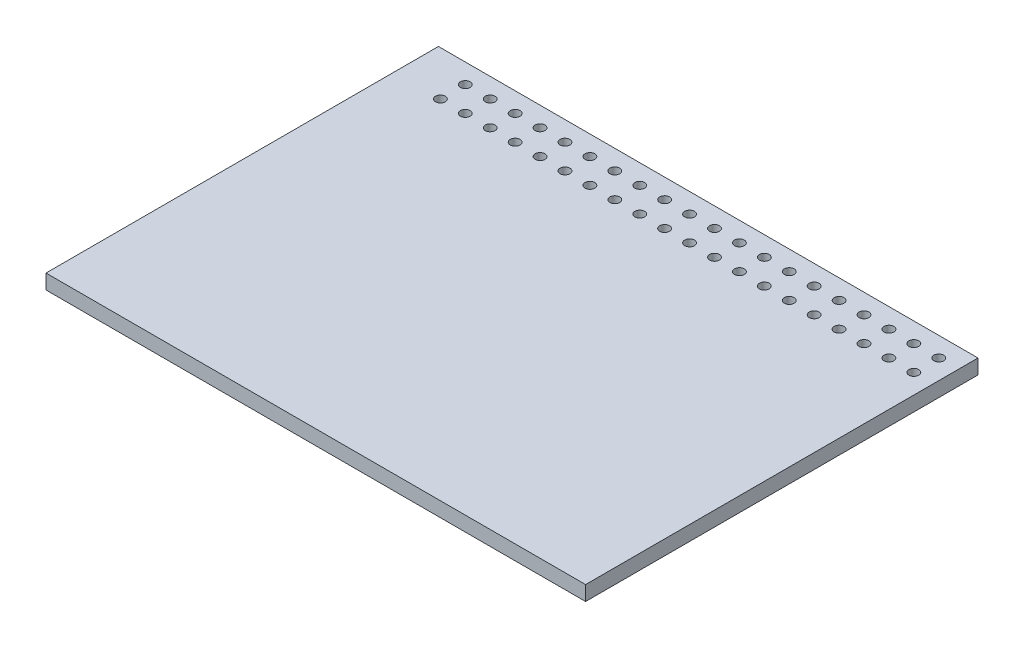
from build123d import *

# Parameters (mm, degrees)
SKETCH1_W           = 55
SKETCH1_H           = 40
SKETCH1_R           = 0.5
BOSS_EXTRUDE1_DEPTH = 1.5


with BuildPart() as part:
    # Sketch1 → Boss-Extrude1 (new body)
    with BuildSketch(Plane(origin=(0, 0, 0), x_dir=(1, 0, 0), z_dir=(0, 1, 0))):
        Rectangle(SKETCH1_W, SKETCH1_H)
        with Locations((25.5, 18)):
            Circle(SKETCH1_R, mode=Mode.SUBTRACT)
        with Locations((22.96, 18)):
            Circle(SKETCH1_R, mode=Mode.SUBTRACT)
        with Locations((20.42, 18)):
            Circle(SKETCH1_R, mode=Mode.SUBTRACT)
        with Locations((17.88, 18)):
            Circle(SKETCH1_R, mode=Mode.SUBTRACT)
        with Locations((15.34, 18)):
            Circle(SKETCH1_R, mode=Mode.SUBTRACT)
        with Locations((12.8, 18)):
            Circle(SKETCH1_R, mode=Mode.SUBTRACT)
        with Locations((10.26, 18)):
            Circle(SKETCH1_R, mode=Mode.SUBTRACT)
        with Locations((7.72, 18)):
            Circle(SKETCH1_R, mode=Mode.SUBTRACT)
        with Locations((5.18, 18)):
            Circle(SKETCH1_R, mode=Mode.SUBTRACT)
        with Locations((2.64, 18)):
            Circle(SKETCH1_R, mode=Mode.SUBTRACT)
        with Locations((0.1, 18)):
            Circle(SKETCH1_R, mode=Mode.SUBTRACT)
        with Locations((-2.44, 18)):
            Circle(SKETCH1_R, mode=Mode.SUBTRACT)
        with Locations((-4.98, 18)):
            Circle(SKETCH1_R, mode=Mode.SUBTRACT)
        with Locations((-7.52, 18)):
            Circle(SKETCH1_R, mode=Mode.SUBTRACT)
        with Locations((-10.06, 18)):
            Circle(SKETCH1_R, mode=Mode.SUBTRACT)
        with Locations((-12.6, 18)):
            Circle(SKETCH1_R, mode=Mode.SUBTRACT)
        with Locations((-15.14, 18)):
            Circle(SKETCH1_R, mode=Mode.SUBTRACT)
        with Locations((-17.68, 18)):
            Circle(SKETCH1_R, mode=Mode.SUBTRACT)
        with Locations((-20.22, 18)):
            Circle(SKETCH1_R, mode=Mode.SUBTRACT)
        with Locations((-22.76, 18)):
            Circle(SKETCH1_R, mode=Mode.SUBTRACT)
        with Locations((22.96, 15.46)):
            Circle(SKETCH1_R, mode=Mode.SUBTRACT)
        with Locations((20.42, 15.46)):
            Circle(SKETCH1_R, mode=Mode.SUBTRACT)
        with Locations((17.88, 15.46)):
            Circle(SKETCH1_R, mode=Mode.SUBTRACT)
        with Locations((15.34, 15.46)):
            Circle(SKETCH1_R, mode=Mode.SUBTRACT)
        with Locations((12.8, 15.46)):
            Circle(SKETCH1_R, mode=Mode.SUBTRACT)
        with Locations((10.26, 15.46)):
            Circle(SKETCH1_R, mode=Mode.SUBTRACT)
        with Locations((7.72, 15.46)):
            Circle(SKETCH1_R, mode=Mode.SUBTRACT)
        with Locations((5.18, 15.46)):
            Circle(SKETCH1_R, mode=Mode.SUBTRACT)
        with Locations((2.64, 15.46)):
            Circle(SKETCH1_R, mode=Mode.SUBTRACT)
        with Locations((0.1, 15.46)):
            Circle(SKETCH1_R, mode=Mode.SUBTRACT)
        with Locations((-2.44, 15.46)):
            Circle(SKETCH1_R, mode=Mode.SUBTRACT)
        with Locations((-4.98, 15.46)):
            Circle(SKETCH1_R, mode=Mode.SUBTRACT)
        with Locations((-7.52, 15.46)):
            Circle(SKETCH1_R, mode=Mode.SUBTRACT)
        with Locations((-10.06, 15.46)):
            Circle(SKETCH1_R, mode=Mode.SUBTRACT)
        with Locations((-12.6, 15.46)):
            Circle(SKETCH1_R, mode=Mode.SUBTRACT)
        with Locations((-15.14, 15.46)):
            Circle(SKETCH1_R, mode=Mode.SUBTRACT)
        with Locations((-17.68, 15.46)):
            Circle(SKETCH1_R, mode=Mode.SUBTRACT)
        with Locations((-20.22, 15.46)):
            Circle(SKETCH1_R, mode=Mode.SUBTRACT)
        with Locations((-22.76, 15.46)):
            Circle(SKETCH1_R, mode=Mode.SUBTRACT)
        with Locations((25.5, 15.46)):
            Circle(SKETCH1_R, mode=Mode.SUBTRACT)
    extrude(amount=BOSS_EXTRUDE1_DEPTH)


solid = part.part
